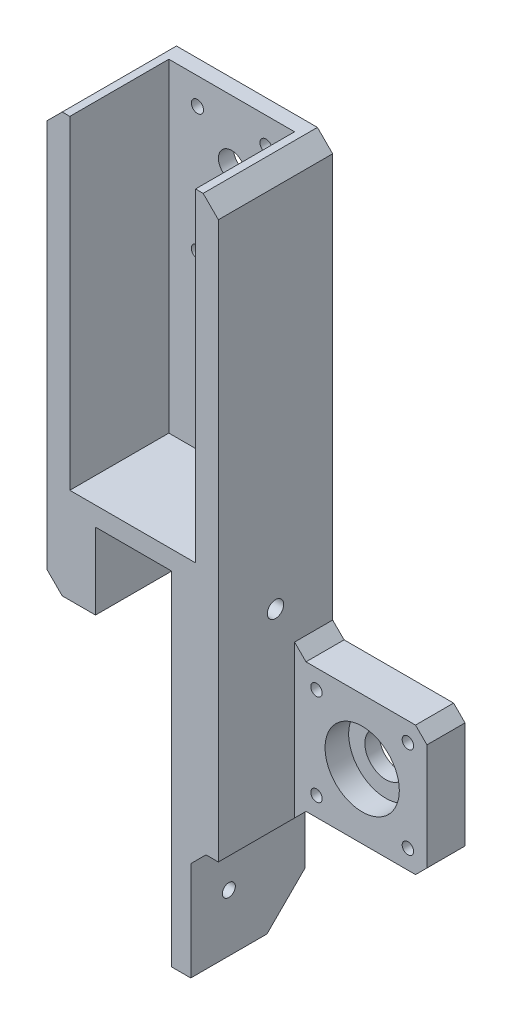
from build123d import *

# Parameters (mm, degrees)
SKETCH_1_W          = 33
SKETCH_1_H          = 47
SKETCH_1_R          = 1.6
SKETCH_1_R_2        = 3.5
EXTRUDE_1_DEPTH     = 4
EXTRUDE_2_DEPTH     = 30
EXTRUDE_START       = -4
SKETCH_4_W          = 33
SKETCH_4_H          = 38
EXTRUDE_3_DEPTH     = 4
SKETCH_6_W          = 50
SKETCH_6_H          = 40
SKETCH_6_R          = 5.5
SKETCH_6_R_2        = 1.5
EXTRUDE_4_DEPTH     = 30
SKETCH_7_W          = 37.75
SKETCH_7_H          = 40
CUT_EXTRUDE_1_DEPTH = 20
SKETCH_8_R          = 9.75
CUT_EXTRUDE_2_DEPTH = 6.2
SKETCH_10_R         = 2.15
CUT_EXTRUDE_4_DEPTH = 136.486392306
SKETCH_11_W         = 30
SKETCH_11_H         = 30
SKETCH_11_R         = 1.7
EXTRUDE_5_DEPTH     = 5
CUT_EXTRUDE_5_DEPTH = 20
CHAMFER_1_SIZE      = 4
CHAMFER_2_SIZE      = 3
CHAMFER_3_SIZE      = 10
SKETCH_13_W         = 30
SKETCH_13_H         = 20
SKETCH_13_R         = 2.15
EXTRUDE_6_DEPTH     = 0.5


with BuildPart() as part:
    # 草图1 → 凸台-拉伸1 (new body)
    with BuildSketch(Plane.XY):
        with Locations((16.5, 23.5)):
            Rectangle(SKETCH_1_W, SKETCH_1_H)
        with Locations((7.5, 40)):
            Circle(SKETCH_1_R, mode=Mode.SUBTRACT)
        with Locations((25.5, 40)):
            Circle(SKETCH_1_R, mode=Mode.SUBTRACT)
        with Locations((7.5, 7)):
            Circle(SKETCH_1_R, mode=Mode.SUBTRACT)
        with Locations((25.5, 7)):
            Circle(SKETCH_1_R, mode=Mode.SUBTRACT)
        with Locations((16.5, 31)):
            Circle(SKETCH_1_R_2, mode=Mode.SUBTRACT)
    extrude(amount=EXTRUDE_1_DEPTH)

    # 草图3 → 凸台-拉伸2 (add)
    with BuildSketch(Plane(origin=(0, 0, 0), x_dir=(-1, 0, 0), z_dir=(0, 0, -1))):
        Polygon((0, -38), (-33, -38), (-33, 47), (-39, 47), (-39, -63), (-26.75, -63), (-26.75, -43), (-6.25, -43), (-6.25, -63), (6, -63), (6, 47), (0, 47), align=None)
    extrude(amount=-EXTRUDE_2_DEPTH)

    # 草图4 → 凸台-拉伸3 (add)
    with BuildSketch(Plane(origin=(0, 0, 0), x_dir=(-1, 0, 0), z_dir=(0, 0, -1)).offset(EXTRUDE_START)):
        with Locations((-16.5, -19)):
            Rectangle(SKETCH_4_W, SKETCH_4_H)
    extrude(amount=EXTRUDE_3_DEPTH)

    # 草图6 → 凸台-拉伸4 (add, through all)
    with BuildSketch(Plane(origin=(0, 0, 0), x_dir=(-1, 0, 0), z_dir=(0, 0, -1))):
        with Locations((-51.75, -83)):
            Rectangle(SKETCH_6_W, SKETCH_6_H)
        with Locations((-56.75, -83)):
            Circle(SKETCH_6_R, mode=Mode.SUBTRACT)
        with Locations((-68.75, -95)):
            Circle(SKETCH_6_R_2, mode=Mode.SUBTRACT)
        with Locations((-68.75, -71)):
            Circle(SKETCH_6_R_2, mode=Mode.SUBTRACT)
        with Locations((-44.75, -95)):
            Circle(SKETCH_6_R_2, mode=Mode.SUBTRACT)
        with Locations((-44.75, -71)):
            Circle(SKETCH_6_R_2, mode=Mode.SUBTRACT)
    extrude(amount=-EXTRUDE_4_DEPTH)

    # 草图7 → 切除-拉伸1 (cut)
    with BuildSketch(Plane.XY.offset(30)):
        with Locations((57.875, -83)):
            Rectangle(SKETCH_7_W, SKETCH_7_H)
    extrude(amount=-CUT_EXTRUDE_1_DEPTH, mode=Mode.SUBTRACT)

    # 草图8 → 切除-拉伸2 (cut)
    with BuildSketch(Plane.XY.offset(10)):
        with Locations((56.75, -83)):
            Circle(SKETCH_8_R)
    extrude(amount=-CUT_EXTRUDE_2_DEPTH, mode=Mode.SUBTRACT)

    # 草图10 → 切除-拉伸4 (cut, through all)
    with BuildSketch(Plane.ZY.offset(6)):
        with Locations(Location((15, -53, 0), (0, 0, 270))):
            Circle(SKETCH_10_R)
    extrude(amount=-CUT_EXTRUDE_4_DEPTH, mode=Mode.SUBTRACT)

    # 草图11 → 凸台-拉伸5 (add)
    with BuildSketch(Plane.ZY.offset(-26.75)):
        with Locations((15, -118)):
            Rectangle(SKETCH_11_W, SKETCH_11_H)
        with Locations(Location((20, -118, 0), (0, 0, 270))):
            Circle(SKETCH_11_R, mode=Mode.SUBTRACT)
    extrude(amount=-EXTRUDE_5_DEPTH)

    # 草图12 → 切除-拉伸5 (cut)
    with BuildSketch(Plane.XY.offset(10)):
        Polygon((39, -103), (76.75, -103), (76.75, -63), (39, -63), (39, -66), (73.75, -66), (73.75, -100), (39, -100), align=None)
    extrude(amount=-CUT_EXTRUDE_5_DEPTH, mode=Mode.SUBTRACT)

    # 倒角1
    chamfer_1_edges = [part.edges().sort_by_distance(p)[0] for p in [
        (31.75, -103, 15),
        (-6, 47, 15),
        (-6, -63, 15),
        (39, 47, 15),
    ]]
    chamfer(chamfer_1_edges, length=CHAMFER_1_SIZE)

    # 倒角2
    chamfer_2_edges = [part.edges().sort_by_distance(p)[0] for p in [
        (39, -100, 5),
        (39, -66, 5),
    ]]
    chamfer(chamfer_2_edges, length=CHAMFER_2_SIZE - 0.0001)  # a hair under: the kernel refuses the full size
    chamfer_2_2_edges = [part.edges().sort_by_distance(p)[0] for p in [
        (73.75, -100, 5),
        (73.75, -66, 5),
    ]]
    chamfer(chamfer_2_2_edges, length=CHAMFER_2_SIZE)

    # 倒角3
    chamfer_3_edges = [part.edges().sort_by_distance(p)[0] for p in [
        (29.25, -133, 0),
    ]]
    chamfer(chamfer_3_edges, length=CHAMFER_3_SIZE)

    # 草图13 → 凸台-拉伸6 (add)
    with BuildSketch(Plane(origin=(6.25, 0, 0), x_dir=(0, 0, -1), z_dir=(1, 0, 0))):
        with Locations((-15, -53)):
            Rectangle(SKETCH_13_W, SKETCH_13_H)
        with Locations(Location((-15, -53, 0), (0, 0, 270))):
            Circle(SKETCH_13_R, mode=Mode.SUBTRACT)
    extrude(amount=EXTRUDE_6_DEPTH)


solid = part.part
